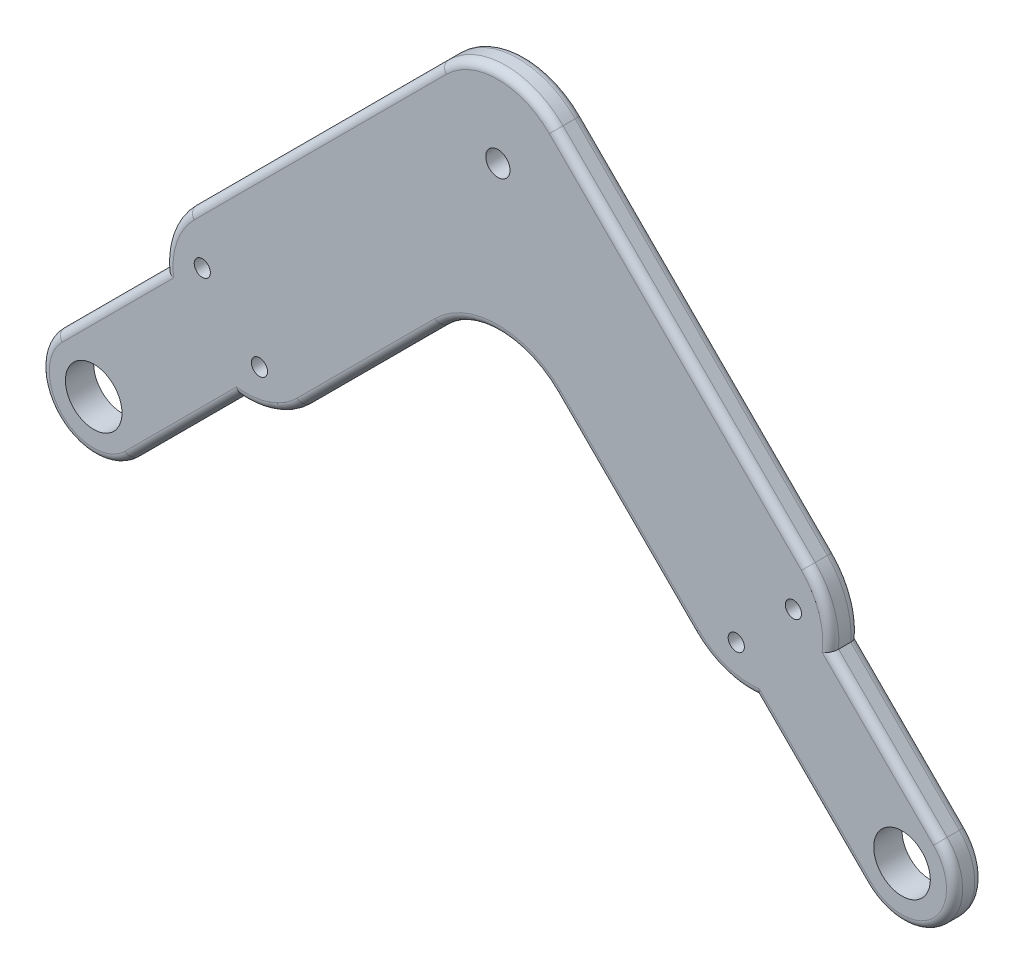
from build123d import *

# Parameters (mm, degrees)
SKETCH5_R           = 3.5
SKETCH5_R_2         = 1.5
SKETCH5_R_3         = 1
BOSS_EXTRUDE1_DEPTH = 3.5
FILLET1_R           = 10
FILLET2_R           = 1
SCALE1_SCALE        = 18


with BuildPart() as part:
    # Sketch5 → Boss-Extrude1 (new body)
    with BuildSketch(Plane.XY):
        with BuildLine():
            Line((-18.03122292, 8.838834765), (-4.596194078, -4.596194078))
            ThreePointArc((-4.596194078, -4.596194078), (4.596194078, -4.596194078), (4.596194078, 4.596194078))
            Line((4.596194078, 4.596194078), (-8.838834765, 18.03122292))
            Line((-8.838834765, 18.03122292), (-6.363961031, 20.506096654))
            Line((-6.363961031, 20.506096654), (-50, 64.142135624))
            Line((-50, 64.142135624), (-93.636038969, 20.506096654))
            Line((-93.636038969, 20.506096654), (-91.161165235, 18.03122292))
            Line((-91.161165235, 18.03122292), (-104.596194078, 4.596194078))
            ThreePointArc((-104.596194078, 4.596194078), (-104.596194078, -4.596194078), (-95.403805922, -4.596194078))
            Line((-95.403805922, -4.596194078), (-81.96877708, 8.838834765))
            Line((-81.96877708, 8.838834765), (-79.493903346, 6.363961031))
            Line((-79.493903346, 6.363961031), (-50, 35.857864376))
            Line((-50, 35.857864376), (-20.506096654, 6.363961031))
            Line((-20.506096654, 6.363961031), (-18.03122292, 8.838834765))
        make_face()
        Circle(SKETCH5_R, mode=Mode.SUBTRACT)
        with Locations((-100, 0)):
            Circle(SKETCH5_R, mode=Mode.SUBTRACT)
        with Locations((-50, 50)):
            Circle(SKETCH5_R_2, mode=Mode.SUBTRACT)
        with Locations((-13.435028843, 20.506096654)):
            Circle(SKETCH5_R_3, mode=Mode.SUBTRACT)
        with Locations((-20.506096654, 13.435028843)):
            Circle(SKETCH5_R_3, mode=Mode.SUBTRACT)
        with Locations((-79.493903346, 13.435028843)):
            Circle(SKETCH5_R_3, mode=Mode.SUBTRACT)
        with Locations((-86.564971157, 20.506096654)):
            Circle(SKETCH5_R_3, mode=Mode.SUBTRACT)
    extrude(amount=BOSS_EXTRUDE1_DEPTH)

    # Fillet1
    # the kernel refuses this fillet: 10 mm, written as the material it adds along each edge
    with BuildSketch(Plane(origin=(-50, 35.857864376, 0), x_dir=(0.7071067811865507, -0.7071067811865444, 0), z_dir=(0, 0, 1))) as fillet1_piece_1:
        with BuildLine():
            CenterArc((FILLET1_R, -FILLET1_R), FILLET1_R, 90, 90)
            Line((0, -FILLET1_R), (0, 0))
            Line((0, 0), (FILLET1_R, 0))
        make_face()
    extrude(amount=3.5)
    # the kernel refuses this fillet: 10 mm, written as the material it takes off along each edge
    with BuildSketch(Plane(origin=(-93.636038969, 20.506096654, -18.998355192), x_dir=(0.7071067811865474, 0.7071067811865478, 0), z_dir=(0, 0, 1)), Plane(origin=(-20.506096654, 6.363961031, -18.998355192), x_dir=(-0.7071067811865507, 0.7071067811865445, 0), z_dir=(0, 0, 1))) as fillet1_2_piece_1:
        with BuildLine():
            CenterArc((7.599342077, -10), FILLET1_R, 90, 49.458398126)
            Line((0, -3.5), (0, 0))
            Line((0, 0), (7.599342077, 0))
        make_face()
    extrude(amount=41.496710384, mode=Mode.SUBTRACT)
    with BuildSketch(Plane(origin=(-79.493903346, 6.363961031, -18.998355192), x_dir=(-0.707106781186547, 0.707106781186548, 0), z_dir=(0, 0, 1)), Plane(origin=(-6.363961031, 20.506096654, -18.998355192), x_dir=(-0.7071067811865441, -0.707106781186551, 0), z_dir=(0, 0, 1))) as fillet1_2_piece_2:
        with BuildLine():
            CenterArc((10, -7.599342077), FILLET1_R, 130.541601874, 49.458398126)
            Line((0, -7.599342077), (0, 0))
            Line((0, 0), (3.5, 0))
        make_face()
    extrude(amount=41.496710384, mode=Mode.SUBTRACT)
    with BuildSketch(Plane(origin=(-50, 64.142135624, -25), x_dir=(0.7071067811865497, -0.7071067811865454, 0), z_dir=(0, 0, 1))) as fillet1_2_piece_3:
        with BuildLine():
            CenterArc((FILLET1_R, -FILLET1_R), FILLET1_R, 90, 90)
            Line((0, -FILLET1_R), (0, 0))
            Line((0, 0), (FILLET1_R, 0))
        make_face()
    extrude(amount=53.5, mode=Mode.SUBTRACT)

    # Fillet2
    fillet2_edges = [part.edges().sort_by_distance(p)[0] for p in [
        (-9.427918977, 22.273151555, 3.5),
        (-77.726848445, 9.427918977, 3.5),
        (-90.572081023, 22.273151555, 3.5),
        (-50, 31.715728753, 0),
        (-50, 31.715728753, 3.5),
        (-88.686291501, 2.121320344, 0),
        (-104.596194078, -4.596194078, 0),
        (-97.878679656, 11.313708499, 0),
        (-2.121320344, 11.313708499, 0),
        (4.596194078, -4.596194078, 0),
        (-11.313708499, 2.121320344, 0),
        (-11.313708499, 2.121320344, 3.5),
        (4.596194078, -4.596194078, 3.5),
        (-2.121320344, 11.313708499, 3.5),
        (-97.878679656, 11.313708499, 3.5),
        (-104.596194078, -4.596194078, 3.5),
        (-88.686291501, 2.121320344, 3.5),
        (-72.666780233, 41.475355391, 0),
        (-27.333219767, 41.475355391, 0),
        (-34.404287579, 20.262151955, 0),
        (-65.595712421, 20.262151955, 0),
        (-50, 60, 0),
        (-22.273151555, 9.427918977, 0),
        (-9.427918977, 22.273151555, 0),
        (-77.726848445, 9.427918977, 0),
        (-90.572081023, 22.273151555, 0),
        (-72.666780233, 41.475355391, 3.5),
        (-65.595712421, 20.262151955, 3.5),
        (-34.404287579, 20.262151955, 3.5),
        (-27.333219767, 41.475355391, 3.5),
        (-50, 60, 3.5),
        (-22.273151555, 9.427918977, 3.5),
    ]]
    fillet(fillet2_edges, radius=FILLET2_R)


with BuildPart() as part_1:
    # Scale1: scaled about (-50.000000001, 26.738967737, 1.75)
    add(part.part.scale(SCALE1_SCALE).moved(Location((850.000000017, -454.562451529, -29.75))))


solid = part_1.part
